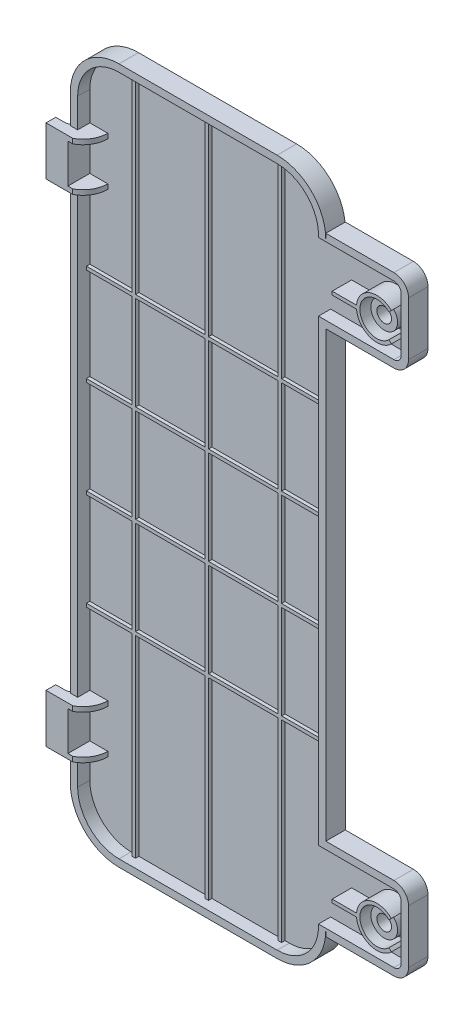
from build123d import *

# Parameters (mm, degrees)
EXTRUDE_1_DEPTH         = 4
SHELL_START             = 1.5
SHELL_1_DEPTH           = 2.5
SKETCH_2_R              = 2.75
SKETCH_2_R_2            = 1.5
EXTRUDE_2_DEPTH         = 4
SKETCH_3_W              = 4.5
SKETCH_3_H              = 10
EXTRUDE_3_DEPTH         = 2
FILLET_1_R              = 1
SKETCH_4_W              = 3.7
SKETCH_4_H              = 1
EXTRUDE_4_DEPTH         = 4.5
CUT_EXTRUDE_START       = -111
CUT_EXTRUDE_1_DEPTH     = 111
SKETCH_6_W              = 14.3
SKETCH_6_H              = 19.3
EXTRUDE_9_DEPTH         = 0.7
SKETCH_7_R              = 2.75
CUT_EXTRUDE_2_DEPTH     = 1.5
EXTRUDE_11_DEPTH        = 1.5
EXTRUDE_11_DEPTH_BACK   = 2.5
EXTRUDE_11_2_DEPTH      = 1.5
EXTRUDE_11_2_DEPTH_BACK = 2.5


# Read off the part's stored shape, not the designer's step: 쉘1
with BuildPart() as part:
    # 스케치1 → 보스-돌출1 (new body)
    with BuildSketch(Plane(origin=(0, 0, 0), x_dir=(0, 1, 0), z_dir=(0, 0, 1))):
        with BuildLine():
            Line((-62.6, -26.25), (-62.6, -40.25))
            ThreePointArc((-62.6, -40.25), (-61.721320344, -42.371320344), (-59.6, -43.25))
            Line((-59.6, -43.25), (-48.6, -43.25))
            ThreePointArc((-48.6, -43.25), (-46.478679656, -42.371320344), (-45.6, -40.25))
            Line((-45.6, -40.25), (-45.6, -26.25))
            Line((-45.6, -26.25), (45.6, -26.25))
            Line((45.6, -26.25), (45.6, -40.25))
            ThreePointArc((45.6, -40.25), (46.478679656, -42.371320344), (48.6, -43.25))
            Line((48.6, -43.25), (59.6, -43.25))
            ThreePointArc((59.6, -43.25), (61.721320344, -42.371320344), (62.6, -40.25))
            Line((62.6, -40.25), (62.6, -26.25))
            Line((62.6, -26.25), (61.5, -26.25))
            ThreePointArc((61.5, -26.25), (68.571067812, -23.321067812), (71.5, -16.25))
            Line((71.5, -16.25), (71.5, 16.25))
            ThreePointArc((71.5, 16.25), (68.571067812, 23.321067812), (61.5, 26.25))
            Line((61.5, 26.25), (-61.5, 26.25))
            ThreePointArc((-61.5, 26.25), (-68.571067812, 23.321067812), (-71.5, 16.25))
            Line((-71.5, 16.25), (-71.5, -16.25))
            ThreePointArc((-71.5, -16.25), (-68.571067812, -23.321067812), (-61.5, -26.25))
            Line((-61.5, -26.25), (-62.6, -26.25))
        make_face()
    extrude(amount=EXTRUDE_1_DEPTH)

    # 쉘1 outline → 쉘1 (cut)
    with BuildSketch(Plane.XY.offset(SHELL_START)):
        with BuildLine():
            ThreePointArc((-16.25, 70), (-22.26040764, 67.51040764), (-24.75, 61.5))
            Line((-24.75, 61.5), (-24.75, -61.5))
            ThreePointArc((-24.75, -61.5), (-22.26040764, -67.51040764), (-16.25, -70))
            Line((-16.25, -70), (16.25, -70))
            ThreePointArc((16.25, -70), (22.400203249, -67.367282165), (24.740583019, -61.1))
            Line((24.740583019, -61.1), (40.25, -61.1))
            ThreePointArc((40.25, -61.1), (41.310660172, -60.660660172), (41.75, -59.6))
            Line((41.75, -59.6), (41.75, -48.6))
            ThreePointArc((41.75, -48.6), (41.310660172, -47.539339828), (40.25, -47.1))
            Line((40.25, -47.1), (24.75, -47.1))
            Line((24.75, -47.1), (24.75, 47.1))
            Line((24.75, 47.1), (40.25, 47.1))
            ThreePointArc((40.25, 47.1), (41.310660172, 47.539339828), (41.75, 48.6))
            Line((41.75, 48.6), (41.75, 59.6))
            ThreePointArc((41.75, 59.6), (41.310660172, 60.660660172), (40.25, 61.1))
            Line((40.25, 61.1), (24.740583019, 61.1))
            ThreePointArc((24.740583019, 61.1), (22.400203249, 67.367282165), (16.25, 70))
            Line((16.25, 70), (-16.25, 70))
        make_face()
    extrude(amount=SHELL_1_DEPTH, mode=Mode.SUBTRACT)

    # 스케치2 → 보스-돌출2 (add)
    # profile 1 of 2: a face of its own
    with BuildSketch(Plane(origin=(0, 0, 0), x_dir=(1, 0, 0), z_dir=(0, 0, -1))):
        with Locations(Location((38.25, -54.1, 0), (0, 0, 180))):
            Circle(SKETCH_2_R)
        with Locations(Location((38.25, -54.1, 0), (0, 0, 180))):
            Circle(SKETCH_2_R_2, mode=Mode.SUBTRACT)
    # profile 2 of 2: a face of its own
    with BuildSketch(Plane(origin=(0, 0, 0), x_dir=(1, 0, 0), z_dir=(0, 0, -1))):
        with Locations(Location((38.25, 54.1, 0), (0, 0, 180))):
            Circle(SKETCH_2_R)
        with Locations(Location((38.25, 54.1, 0), (0, 0, 180))):
            Circle(SKETCH_2_R_2, mode=Mode.SUBTRACT)
    extrude(amount=-EXTRUDE_2_DEPTH)

    # 스케치3 → 보스-돌출3 (add)
    with BuildSketch(Plane.XY.offset(4)):
        with Locations((-27, 50.5)):
            Rectangle(SKETCH_3_W, SKETCH_3_H)
        with Locations((-27, -50.5)):
            Rectangle(SKETCH_3_W, SKETCH_3_H)
    extrude(amount=EXTRUDE_3_DEPTH)

    # 필렛1
    # the kernel refuses this fillet: 1 mm, written as the material it adds along each edge
    with BuildSketch(Plane(origin=(-26.25, 55.5, 4), x_dir=(0, 0, -1), z_dir=(0, -1, 0)), Plane(origin=(-26.25, -45.5, 4), x_dir=(0, 0, -1), z_dir=(0, -1, 0))) as fillet_1_piece_1:
        with BuildLine():
            CenterArc((FILLET_1_R, -FILLET_1_R), FILLET_1_R, 90, 90)
            Line((0, -FILLET_1_R), (0, 0))
            Line((0, 0), (FILLET_1_R, 0))
        make_face()
    extrude(amount=10)

    # 스케치4 → 보스-돌출4 (add)
    with BuildSketch(Plane.XY.offset(6)):
        with Locations((-22.9, 55)):
            Rectangle(SKETCH_4_W, SKETCH_4_H)
        with Locations((-22.9, 46)):
            Rectangle(SKETCH_4_W, SKETCH_4_H)
        with Locations((-22.9, -46)):
            Rectangle(SKETCH_4_W, SKETCH_4_H)
        with Locations((-22.9, -55)):
            Rectangle(SKETCH_4_W, SKETCH_4_H)
    extrude(amount=-EXTRUDE_4_DEPTH)

    # 스케치5 → 컷-돌출1 (cut)
    with BuildSketch(Plane.XZ.offset(55.5).offset(CUT_EXTRUDE_START)):
        with BuildLine():
            Line((-21.05, 1.5), (-21.05, 6))
            Line((-21.05, 6), (-23.757771288, 6))
            ThreePointArc((-23.757771288, 6), (-21.779134481, 4.125929614), (-21.05, 1.5))
        make_face()
    extrude(amount=CUT_EXTRUDE_1_DEPTH, mode=Mode.SUBTRACT)

    # 스케치6 → 보스-돌출9 (add)
    with BuildSketch(Plane.XY.offset(1.5)):
        Polygon((0.35, -30.35), (14.65, -30.35), (14.65, -70), (15.35, -70), (15.35, -30.35), (24.75, -30.35), (24.75, -29.65), (15.35, -29.65), (15.35, -10.35), (24.75, -10.35), (24.75, -9.65), (15.35, -9.65), (15.35, 9.65), (24.75, 9.65), (24.75, 10.35), (15.35, 10.35), (15.35, 29.65), (24.75, 29.65), (24.75, 30.35), (15.35, 30.35), (15.35, 70), (14.65, 70), (14.65, 30.35), (0.35, 30.35), (0.35, 70), (-0.35, 70), (-0.35, 30.35), (-14.65, 30.35), (-14.65, 70), (-15.35, 70), (-15.35, 30.35), (-24.75, 30.35), (-24.75, 29.65), (-15.35, 29.65), (-15.35, 10.35), (-24.75, 10.35), (-24.75, 9.65), (-15.35, 9.65), (-15.35, -9.65), (-24.75, -9.65), (-24.75, -10.35), (-15.35, -10.35), (-15.35, -29.65), (-24.75, -29.65), (-24.75, -30.35), (-15.35, -30.35), (-15.35, -70), (-14.65, -70), (-14.65, -30.35), (-0.35, -30.35), (-0.35, -70), (0.35, -70), align=None)
        with Locations((-7.5, -20)):
            Rectangle(SKETCH_6_W, SKETCH_6_H, mode=Mode.SUBTRACT)
        with Locations((-7.5, 0)):
            Rectangle(SKETCH_6_W, SKETCH_6_H, mode=Mode.SUBTRACT)
        with Locations((7.5, -20)):
            Rectangle(SKETCH_6_W, SKETCH_6_H, mode=Mode.SUBTRACT)
        with Locations((7.5, 0)):
            Rectangle(SKETCH_6_W, SKETCH_6_H, mode=Mode.SUBTRACT)
        with Locations((-7.5, 20)):
            Rectangle(SKETCH_6_W, SKETCH_6_H, mode=Mode.SUBTRACT)
        with Locations((7.5, 20)):
            Rectangle(SKETCH_6_W, SKETCH_6_H, mode=Mode.SUBTRACT)
    extrude(amount=EXTRUDE_9_DEPTH)

    # 스케치7 → 컷-돌출2 (cut)
    with BuildSketch(Plane(origin=(0, 0, 0), x_dir=(1, 0, 0), z_dir=(0, 0, -1))):
        with Locations(Location((38.25, 54.1, 0), (0, 0, 180))):
            Circle(SKETCH_7_R)
        with Locations(Location((38.25, -54.1, 0), (0, 0, 180))):
            Circle(SKETCH_7_R)
    extrude(amount=-CUT_EXTRUDE_2_DEPTH, mode=Mode.SUBTRACT)


with BuildPart() as cut_extrude_2_piece_1:
    # of the separate pieces the step leaves, piece 1, a body of its own (cut_extrude_2_pieces)
    add(part.part.solids().sort_by_distance((-26.25, 55.5, 3))[0])


with BuildPart() as cut_extrude_2_piece_2:
    # of the separate pieces the step leaves, piece 2, a body of its own (cut_extrude_2_pieces)
    add(part.part.solids().sort_by_distance((35.5, -54.1, 4))[0])


with BuildPart() as cut_extrude_2_piece_3:
    # of the separate pieces the step leaves, piece 3, a body of its own (cut_extrude_2_pieces)
    add(part.part.solids().sort_by_distance((35.5, 54.1, 4))[0])


with BuildPart() as body_4:
    # 스케치9 → 보스-돌출11 (new, two sides: drawn at the far end of the back side and taken through both)
    with BuildSketch(Plane.XY.offset(4).offset(-EXTRUDE_11_DEPTH_BACK)):
        with BuildLine():
            Line((40.724873734, 56.574873734), (41.219848481, 57.069848481))
            ThreePointArc((41.219848481, 57.069848481), (36.805947516, 58.043946301), (34.06460874, 54.45))
            Line((34.06460874, 54.45), (29.06460874, 54.45))
            Line((29.06460874, 54.45), (29.06460874, 53.75))
            Line((29.06460874, 53.75), (34.06460874, 53.75))
            ThreePointArc((34.06460874, 53.75), (36.805947516, 50.156053699), (41.219848481, 51.130151519))
            Line((41.219848481, 51.130151519), (40.724873734, 51.625126266))
            ThreePointArc((40.724873734, 51.625126266), (34.75, 54.1), (40.724873734, 56.574873734))
        make_face()
    extrude(amount=EXTRUDE_11_DEPTH + EXTRUDE_11_DEPTH_BACK)


with BuildPart() as body_5:
    # 스케치9 → Extrude 11 2 (new, two sides: drawn at the far end of the back side and taken through both)
    with BuildSketch(Plane.XY.offset(4).offset(-EXTRUDE_11_2_DEPTH_BACK)):
        with BuildLine():
            Line((29.06460874, -53.75), (34.06460874, -53.75))
            ThreePointArc((34.06460874, -53.75), (36.805947516, -50.156053699), (41.219848481, -51.130151519))
            Line((41.219848481, -51.130151519), (40.724873734, -51.625126266))
            ThreePointArc((40.724873734, -51.625126266), (34.75, -54.1), (40.724873734, -56.574873734))
            Line((40.724873734, -56.574873734), (41.219848481, -57.069848481))
            ThreePointArc((41.219848481, -57.069848481), (36.805947516, -58.043946301), (34.06460874, -54.45))
            Line((34.06460874, -54.45), (29.06460874, -54.45))
            Line((29.06460874, -54.45), (29.06460874, -53.75))
        make_face()
    extrude(amount=EXTRUDE_11_2_DEPTH + EXTRUDE_11_2_DEPTH_BACK)


solid = Compound([cut_extrude_2_piece_1.part, cut_extrude_2_piece_2.part, cut_extrude_2_piece_3.part, body_4.part, body_5.part])
